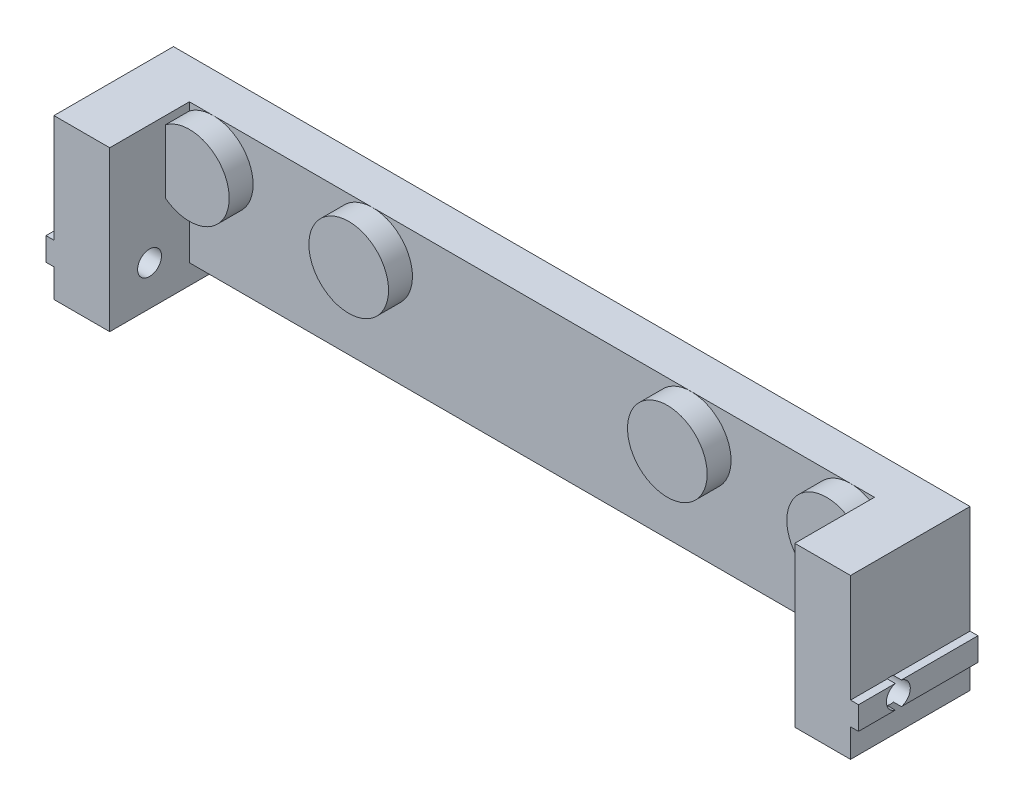
from build123d import *

# Parameters (mm, degrees)
MAIN_DEPTH               = 15
SKETCH2_W                = 86
SKETCH2_H                = 20
TOPEXTRUSION_DEPTH       = 10
SKETCH5_R                = 5
REINFORCEMENTHOLES_DEPTH = 3
SKETCH3_R                = 3
HOLES_DEPTH              = 5
SKETCH4_R                = 1.5
FIXHOLES_DEPTH           = 106.019045892
SKETCH6_W                = 86
SKETCH6_H                = 2.5
FORWINDOW_DEPTH          = 56.686623169
SKETCH7_R                = 1.25
CUT_EXTRUDE2_DEPTH       = 10


with BuildPart() as part:
    # Sketch1 → Main (new body)
    with BuildSketch(Plane.XY):
        Polygon((-50, 0), (50, 0), (50, 3.55), (51, 3.55), (51, 6.45), (50, 6.45), (50, 20), (-50, 20), (-50, 6.45), (-51, 6.45), (-51, 3.55), (-50, 3.55), align=None)
    extrude(amount=MAIN_DEPTH)

    # Sketch2 → TopExtrusion (cut)
    with BuildSketch(Plane.XY.offset(15)):
        with Locations((0, 10)):
            Rectangle(SKETCH2_W, SKETCH2_H)
    extrude(amount=-TOPEXTRUSION_DEPTH, mode=Mode.SUBTRACT)

    # Sketch5 → ReinforcementHoles (add)
    with BuildSketch(Plane.XY.offset(5)):
        with Locations((-40, 15)):
            Circle(SKETCH5_R)
        with Locations((-20, 15)):
            Circle(SKETCH5_R)
        with Locations((20, 15)):
            Circle(SKETCH5_R)
        with Locations((40, 15)):
            Circle(SKETCH5_R)
    extrude(amount=REINFORCEMENTHOLES_DEPTH)

    # Sketch3 → Holes (cut)
    with BuildSketch(Plane.XY):
        with Locations((-40, 15)):
            Circle(SKETCH3_R)
        with Locations((20, 15)):
            Circle(SKETCH3_R)
    holes = extrude(amount=HOLES_DEPTH, mode=Mode.SUBTRACT)

    # Mirror1: Holes across plane
    add(holes.mirror(Plane(origin=(0, 0, 0), x_dir=(0, 0, 1), z_dir=(1, 0, 0))), mode=Mode.SUBTRACT)

    # Sketch4 → FixHoles (cut, through all)
    with BuildSketch(Plane(origin=(51, 0, 0), x_dir=(0, 0, -1), z_dir=(1, 0, 0))):
        with Locations((-10, 5)):
            Circle(SKETCH4_R)
    extrude(amount=-FIXHOLES_DEPTH, mode=Mode.SUBTRACT)

    # Sketch6 → ForWindow (cut, through all)
    with BuildSketch(Plane.XY.offset(5)):
        with Locations((0, 1.25)):
            Rectangle(SKETCH6_W, SKETCH6_H)
    extrude(amount=-FORWINDOW_DEPTH, mode=Mode.SUBTRACT)

    # Sketch7 → Cut-Extrude2 (cut)
    with BuildSketch(Plane(origin=(0, 2.5, 0), x_dir=(-1, 0, 0), z_dir=(0, -1, 0))):
        with Locations((36, -2.5)):
            Circle(SKETCH7_R)
        with Locations((-36, -2.5)):
            Circle(SKETCH7_R)
    extrude(amount=-CUT_EXTRUDE2_DEPTH, mode=Mode.SUBTRACT)


solid = part.part
